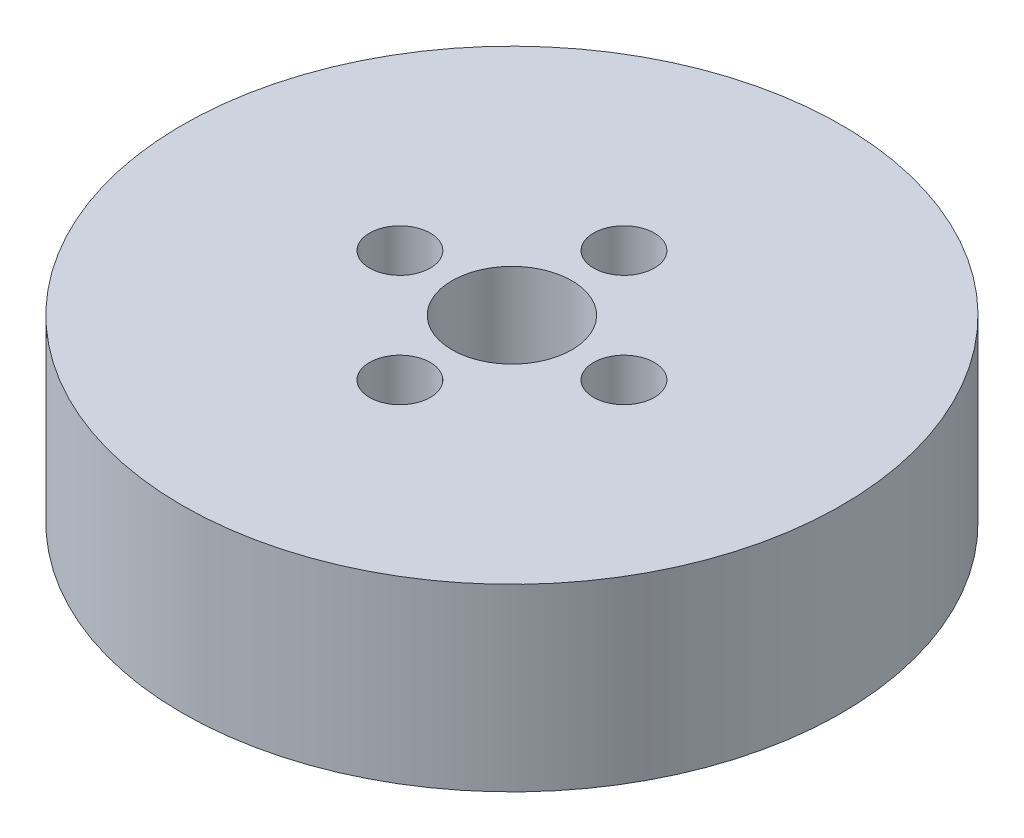
from build123d import *

# Parameters (mm, degrees)
SKETCH1_R           = 27.5
BOSS_EXTRUDE1_DEPTH = 15
SKETCH2_R           = 5
CUT_EXTRUDE1_DEPTH  = 42.683330001
SKETCH3_R           = 2.534672143
CUT_EXTRUDE2_DEPTH  = 11.683898907
CIRPATTERN1_COUNT   = 4


with BuildPart() as part:
    # Sketch1 → Boss-Extrude1 (new body)
    with BuildSketch(Plane(origin=(0, 0, 0), x_dir=(1, 0, 0), z_dir=(0, 1, 0))):
        Circle(SKETCH1_R)
    extrude(amount=BOSS_EXTRUDE1_DEPTH)

    # Sketch2 → Cut-Extrude1 (cut, through all)
    with BuildSketch(Plane(origin=(0, 0, 0), x_dir=(1, 0, 0), z_dir=(0, 1, 0))):
        Circle(SKETCH2_R)
    extrude(amount=CUT_EXTRUDE1_DEPTH, mode=Mode.SUBTRACT)

    # Sketch3 → Cut-Extrude2 (cut)
    with BuildSketch(Plane(origin=(0, 15, 0), x_dir=(1, 0, 0), z_dir=(0, 1, 0))):
        with Locations((-9.347834619, 0)):
            Circle(SKETCH3_R)
    cut_extrude2 = extrude(amount=-CUT_EXTRUDE2_DEPTH, mode=Mode.SUBTRACT)

    # CirPattern1: Cut-Extrude2 ×4 about axis
    cirpattern1_axis = Axis((0, 0, 0), (0, 1, 0))
    for i in range(1, CIRPATTERN1_COUNT):
        add(cut_extrude2.rotate(cirpattern1_axis, i * 360 / CIRPATTERN1_COUNT), mode=Mode.SUBTRACT)


solid = part.part
